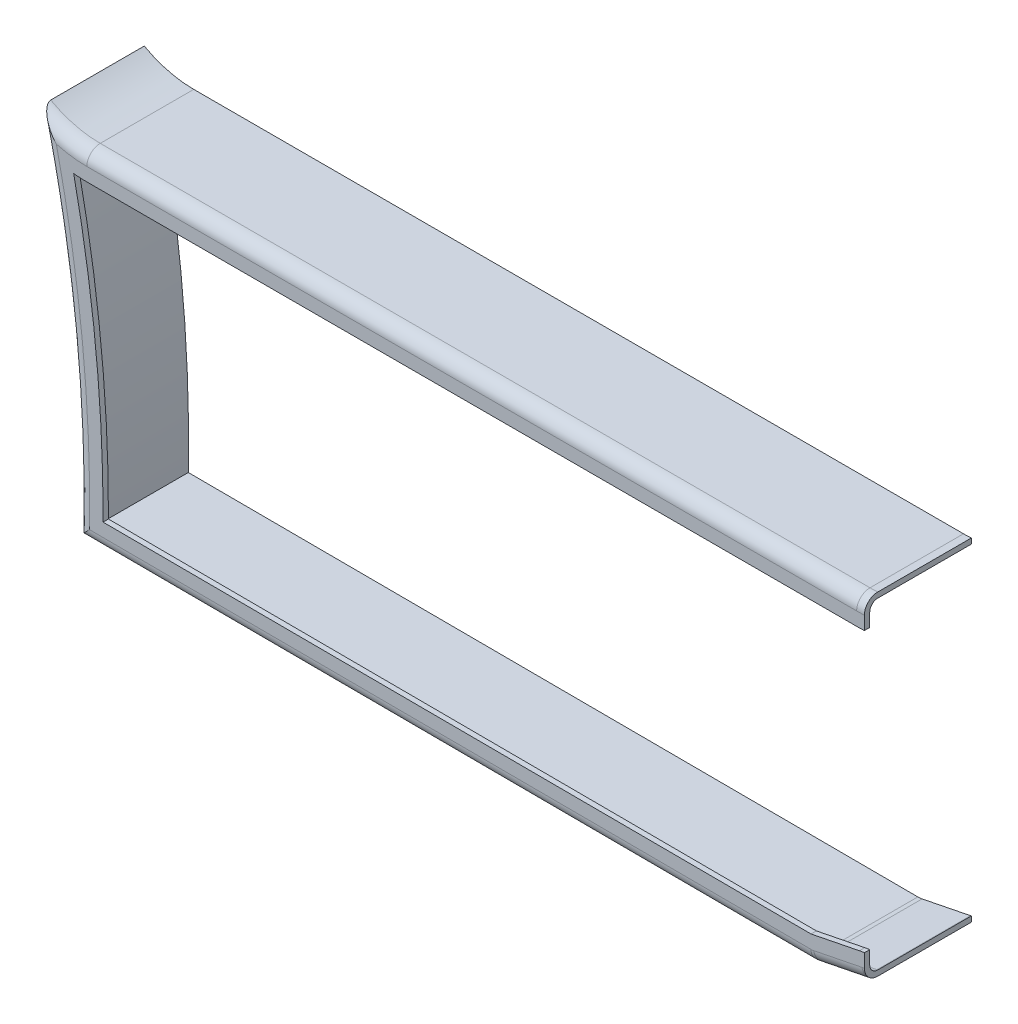
from build123d import *

# Parameters (mm, degrees)
BULK_EXTRUDE_DEPTH      = 15
BULK_EXTRUDE_DEPTH_BACK = 25
FILLET1_R               = 10
FILLET2_R               = 5
SHELL1_T                = -2
CUT_EXTRUDE1_DEPTH      = 422.355324193
SKETCH5_W               = 480.857128425
SKETCH5_H               = 352.628560845
CUT_EXTRUDE2_DEPTH      = 421.453694508


with BuildPart() as part:
    # CAR IF PROFILE (LINKED) → BULK EXTRUDE (new, two sides: drawn at the far end of the back side and taken through both)
    with BuildSketch(Plane.XY.offset(-4).offset(-BULK_EXTRUDE_DEPTH_BACK)):
        with BuildLine():
            Line((-295.078591169, -111.946264919), (-19, -113))
            Line((-19, -113), (1, -109))
            ThreePointArc((1, -109), (198.928007183, -103.099755232), (396.5667255, -90.883129746))
            ThreePointArc((396.5667255, -90.883129746), (402.821856452, -86.996162981), (403.25, -79.644165499))
            Line((403.25, -79.644165499), (375, -16.408243852))
            ThreePointArc((375, -16.408243852), (367.197341759, -5.922676773), (355.67663631, 0.25))
            ThreePointArc((355.67663631, 0.25), (181.807074426, 28.087002744), (6.133486165, 16.073940737))
            ThreePointArc((6.133486165, 16.073940737), (1.632399478, 15.45641124), (-2.906159592, 15.25))
            Line((-2.906159592, 15.25), (-291, 15.25))
            ThreePointArc((-291, 15.25), (-300.563739268, 16.468850921), (-309.516063375, 20.047481868))
            ThreePointArc((-309.516063375, 20.047481868), (-297.896277606, -45.46800484), (-295.078591169, -111.946264919))
        make_face()
    extrude(amount=BULK_EXTRUDE_DEPTH + BULK_EXTRUDE_DEPTH_BACK)

    # Fillet1
    fillet1_edges = [part.edges().sort_by_distance(p)[0] for p in [
        (-19, -113, -9),
        (1, -109, -9),
    ]]
    fillet(fillet1_edges, radius=FILLET1_R)

    # Fillet2
    fillet2_edges = [part.edges().sort_by_distance(p)[0] for p in [
        (-300.563739268, 16.468850921, 11),
        (-146.953079796, 15.25, 11),
        (1.632399478, 15.45641124, 11),
        (181.807074426, 28.087002744, 11),
        (367.197341759, -5.922676773, 11),
        (389.125, -48.026204675, 11),
        (402.821856452, -86.996162981, 11),
        (199.387162842, -103.07870895, 11),
        (1.004085255, -109.042035917, 11),
        (-8.956141872, -110.991228374, 11),
        (-19.004911384, -112.949415553, 11),
        (-297.896277606, -45.46800484, 11),
        (-157.544026805, -112.471206005, 11),
    ]]
    fillet(fillet2_edges, radius=FILLET2_R)

    # Shell1
    shell1_openings = [part.faces().sort_by_distance(p)[0] for p in [
        (34.519937881, -44.538458496, -29),
    ]]
    offset(amount=SHELL1_T, openings=shell1_openings)

    # Sketch4 → Cut-Extrude1 (cut, through all)
    with BuildSketch(Plane.XY.offset(11)):
        with BuildLine():
            Line((-2.906159592, 5.25), (-291, 5.25))
            ThreePointArc((-291, 5.25), (-293.467586904, 5.31329662), (-295.928683536, 5.503019997))
            ThreePointArc((-295.928683536, 5.503019997), (-287.577960903, -47.94901701), (-284.936393206, -101.984902759))
            Line((-284.936393206, -101.984902759), (-19.971294779, -102.996219929))
            Line((-19.971294779, -102.996219929), (-1.863311668, -99.374623306))
            ThreePointArc((-1.863311668, -99.374623306), (-0.050840526, -99.097835014), (1.779362143, -98.988192003))
            ThreePointArc((1.779362143, -98.988192003), (197.512147749, -93.154044276), (392.962527718, -81.13282923))
            Line((392.962527718, -81.13282923), (365.86967909, -20.487121158))
            ThreePointArc((365.86967909, -20.487121158), (360.667906929, -13.496743105), (352.98743663, -9.381625256))
            ThreePointArc((352.98743663, -9.381625256), (181.354834101, 18.097234044), (7.941415316, 6.238728885))
            ThreePointArc((7.941415316, 6.238728885), (2.540111292, 5.497693488), (-2.906159592, 5.25))
        make_face()
    extrude(amount=-CUT_EXTRUDE1_DEPTH, mode=Mode.SUBTRACT)

    # Sketch5 → Cut-Extrude2 (cut, through all)
    with BuildSketch(Plane(origin=(0, 0, 0), x_dir=(0, 0, -1), z_dir=(1, 0, 0))):
        with Locations((12.476210215, -43.906440872)):
            Rectangle(SKETCH5_W, SKETCH5_H)
    extrude(amount=CUT_EXTRUDE2_DEPTH, mode=Mode.SUBTRACT)


solid = part.part
